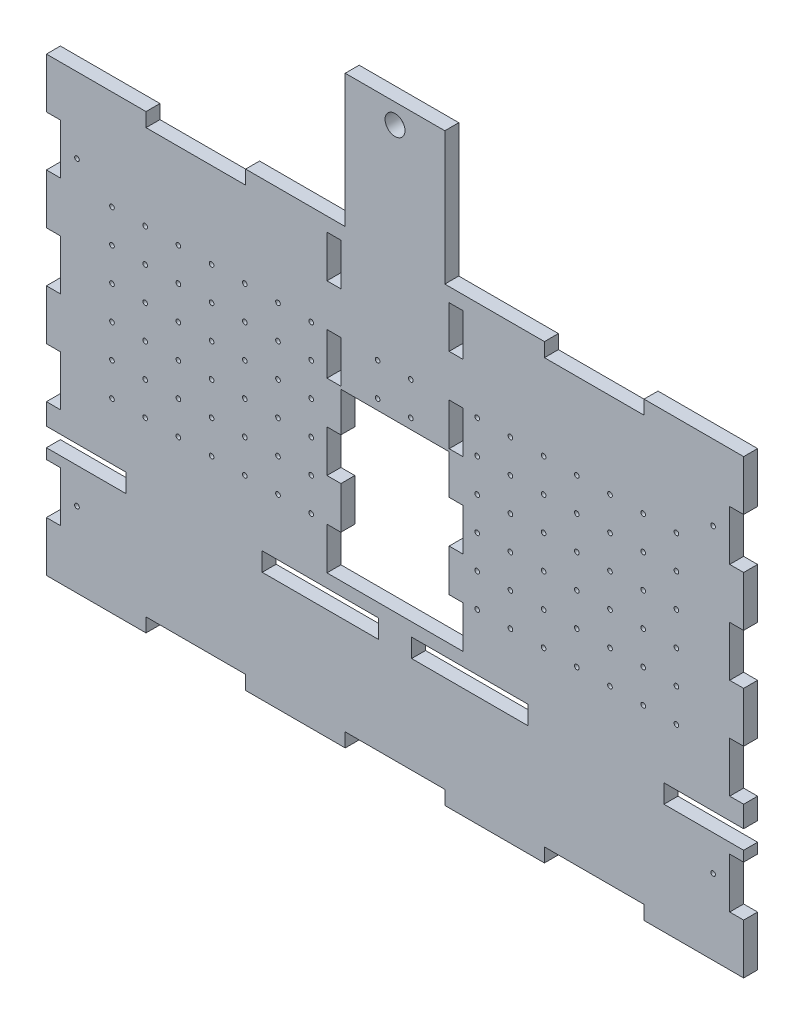
from build123d import *

# Parameters (mm, degrees)
SKETCH1_W           = 266.7
SKETCH1_H           = 172.72
BOSS_EXTRUDE1_DEPTH = 5.334
SKETCH2_W           = 38.1
SKETCH2_H           = 5.334
CUT_EXTRUDE1_DEPTH  = 165.701204222
SKETCH5_W           = 44.45
SKETCH5_H           = 7.112
CUT_EXTRUDE3_DEPTH  = 165.701204222
SKETCH9_W           = 5.334
SKETCH9_H           = 19.191111111
CUT_EXTRUDE7_DEPTH  = 165.701204222
SKETCH10_W          = 38.1
SKETCH10_H          = 5.334
BOSS_EXTRUDE2_DEPTH = 50.8
SKETCH11_W          = 6.604
SKETCH11_H          = 40.64
CUT_EXTRUDE8_DEPTH  = 197.710659379
SKETCH12_R          = 3.81
CUT_EXTRUDE9_DEPTH  = 197.710659379
SKETCH14_R          = 0.889
CUT_EXTRUDE11_DEPTH = 197.710659379
SKETCH15_W          = 6.604
SKETCH15_H          = 10.16
CUT_EXTRUDE12_DEPTH = 197.710659379
SKETCH16_W          = 41.402
SKETCH16_H          = 63.5
CUT_EXTRUDE13_DEPTH = 197.710659379
SKETCH17_W          = 5.334
SKETCH17_H          = 16.124650759
SKETCH17_H_2        = 16.124650758
CUT_EXTRUDE14_DEPTH = 197.710659379
SKETCH18_W          = 38.1
SKETCH18_H          = 56.134
BOSS_EXTRUDE3_DEPTH = 5.334
SKETCH19_W          = 34.756768033
SKETCH19_H          = 54.94363668
CUT_EXTRUDE15_DEPTH = 197.710659379
SKETCH20_R          = 3.81
CUT_EXTRUDE16_DEPTH = 197.710659379
SKETCH21_R          = 0.889
CUT_EXTRUDE17_DEPTH = 197.710659379


with BuildPart() as part:
    # Sketch1 → Boss-Extrude1 (new body)
    with BuildSketch(Plane.XY):
        with Locations((5.474099752, 2.104142138)):
            Rectangle(SKETCH1_W, SKETCH1_H)
    extrude(amount=BOSS_EXTRUDE1_DEPTH)

    # Sketch2 → Cut-Extrude1 (cut, through all)
    with BuildSketch(Plane.XY.offset(5.334)):
        with Locations((-70.725900248, -81.588857862)):
            Rectangle(SKETCH2_W, SKETCH2_H)
        with Locations((5.474099752, -81.588857862)):
            Rectangle(SKETCH2_W, SKETCH2_H)
        with Locations((81.674099752, -81.588857862)):
            Rectangle(SKETCH2_W, SKETCH2_H)
        with Locations((81.674099752, 85.797142138)):
            Rectangle(SKETCH2_W, SKETCH2_H)
        with Locations((5.474099752, 85.797142138)):
            Rectangle(SKETCH2_W, SKETCH2_H)
        with Locations((-70.725900248, 85.797142138)):
            Rectangle(SKETCH2_W, SKETCH2_H)
    extrude(amount=-CUT_EXTRUDE1_DEPTH, mode=Mode.SUBTRACT)

    # Sketch5 → Cut-Extrude3 (cut, through all)
    with BuildSketch(Plane.XY.offset(5.334)):
        with Locations((34.049099752, -38.378413173)):
            Rectangle(SKETCH5_W, SKETCH5_H)
        with Locations((-23.100900248, -38.378413173)):
            Rectangle(SKETCH5_W, SKETCH5_H)
        with Locations((-119.620900248, -38.378413173)):
            Rectangle(SKETCH5_W, SKETCH5_H)
        with Locations((130.569099752, -38.378413173)):
            Rectangle(SKETCH5_W, SKETCH5_H)
    extrude(amount=-CUT_EXTRUDE3_DEPTH, mode=Mode.SUBTRACT)

    # Sketch9 → Cut-Extrude7 (cut, through all)
    with BuildSketch(Plane.XY.offset(5.334)):
        with Locations((-125.208900248, -55.469191196)):
            Rectangle(SKETCH9_W, SKETCH9_H)
        with Locations((-125.208900248, -17.086968973)):
            Rectangle(SKETCH9_W, SKETCH9_H)
        with Locations((-125.208900248, 21.295253249)):
            Rectangle(SKETCH9_W, SKETCH9_H)
        with Locations((-125.208900248, 59.677475472)):
            Rectangle(SKETCH9_W, SKETCH9_H)
        with Locations((136.157099752, 59.677475472)):
            Rectangle(SKETCH9_W, SKETCH9_H)
        with Locations((136.157099752, 21.295253249)):
            Rectangle(SKETCH9_W, SKETCH9_H)
        with Locations((136.157099752, -17.086968973)):
            Rectangle(SKETCH9_W, SKETCH9_H)
        with Locations((136.157099752, -55.469191196)):
            Rectangle(SKETCH9_W, SKETCH9_H)
    extrude(amount=-CUT_EXTRUDE7_DEPTH, mode=Mode.SUBTRACT)

    # Sketch10 → Boss-Extrude2 (add)
    with BuildSketch(Plane(origin=(0, 88.464142138, 0), x_dir=(1, 0, 0), z_dir=(0, 1, 0))):
        with Locations((43.574099752, -2.667)):
            Rectangle(SKETCH10_W, SKETCH10_H)
    extrude(amount=BOSS_EXTRUDE2_DEPTH)

    # Sketch11 → Cut-Extrude8 (cut, through all)
    with BuildSketch(Plane(origin=(0, 0, 0), x_dir=(-1, 0, 0), z_dir=(0, 0, -1))):
        with Locations((-27.826099752, 108.784142138)):
            Rectangle(SKETCH11_W, SKETCH11_H)
    extrude(amount=-CUT_EXTRUDE8_DEPTH, mode=Mode.SUBTRACT)

    # Sketch12 → Cut-Extrude9 (cut, through all)
    with BuildSketch(Plane.XY.offset(5.334)):
        with Locations((43.574099752, 130.476471297)):
            Circle(SKETCH12_R)
    extrude(amount=-CUT_EXTRUDE9_DEPTH, mode=Mode.SUBTRACT)

    # Sketch14 → Cut-Extrude11 (cut, through all)
    with BuildSketch(Plane.XY.offset(5.334)):
        with Locations((-102.797588144, 50.364142138)):
            Circle(SKETCH14_R)
        with Locations((-90.097588144, 50.364142138)):
            Circle(SKETCH14_R)
        with Locations((-77.397588144, 50.364142138)):
            Circle(SKETCH14_R)
        with Locations((-64.697588144, 50.364142138)):
            Circle(SKETCH14_R)
        with Locations((-51.997588144, 50.364142138)):
            Circle(SKETCH14_R)
        with Locations((-39.297588144, 50.364142138)):
            Circle(SKETCH14_R)
        with Locations((-26.597588144, 50.364142138)):
            Circle(SKETCH14_R)
        with Locations((-1.197588144, 50.364142138)):
            Circle(SKETCH14_R)
        with Locations((11.502411856, 50.364142138)):
            Circle(SKETCH14_R)
        with Locations((36.902411856, 50.364142138)):
            Circle(SKETCH14_R)
        with Locations((49.602411856, 50.364142138)):
            Circle(SKETCH14_R)
        with Locations((62.302411856, 50.364142138)):
            Circle(SKETCH14_R)
        with Locations((75.002411856, 50.364142138)):
            Circle(SKETCH14_R)
        with Locations((87.702411856, 50.364142138)):
            Circle(SKETCH14_R)
        with Locations((100.402411856, 50.364142138)):
            Circle(SKETCH14_R)
        with Locations((113.102411856, 50.364142138)):
            Circle(SKETCH14_R)
        with Locations((-102.797588144, 37.664142138)):
            Circle(SKETCH14_R)
        with Locations((-90.097588144, 37.664142138)):
            Circle(SKETCH14_R)
        with Locations((-77.397588144, 37.664142138)):
            Circle(SKETCH14_R)
        with Locations((-64.697588144, 37.664142138)):
            Circle(SKETCH14_R)
        with Locations((-51.997588144, 37.664142138)):
            Circle(SKETCH14_R)
        with Locations((-39.297588144, 37.664142138)):
            Circle(SKETCH14_R)
        with Locations((-26.597588144, 37.664142138)):
            Circle(SKETCH14_R)
        with Locations((-1.197588144, 37.664142138)):
            Circle(SKETCH14_R)
        with Locations((11.502411856, 37.664142138)):
            Circle(SKETCH14_R)
        with Locations((36.902411856, 37.664142138)):
            Circle(SKETCH14_R)
        with Locations((49.602411856, 37.664142138)):
            Circle(SKETCH14_R)
        with Locations((62.302411856, 37.664142138)):
            Circle(SKETCH14_R)
        with Locations((75.002411856, 37.664142138)):
            Circle(SKETCH14_R)
        with Locations((87.702411856, 37.664142138)):
            Circle(SKETCH14_R)
        with Locations((100.402411856, 37.664142138)):
            Circle(SKETCH14_R)
        with Locations((113.102411856, 37.664142138)):
            Circle(SKETCH14_R)
        with Locations((-102.797588144, 24.964142138)):
            Circle(SKETCH14_R)
        with Locations((-90.097588144, 24.964142138)):
            Circle(SKETCH14_R)
        with Locations((-77.397588144, 24.964142138)):
            Circle(SKETCH14_R)
        with Locations((-64.697588144, 24.964142138)):
            Circle(SKETCH14_R)
        with Locations((-51.997588144, 24.964142138)):
            Circle(SKETCH14_R)
        with Locations((-39.297588144, 24.964142138)):
            Circle(SKETCH14_R)
        with Locations((-26.597588144, 24.964142138)):
            Circle(SKETCH14_R)
        with Locations((-1.197588144, 24.964142138)):
            Circle(SKETCH14_R)
        with Locations((11.502411856, 24.964142138)):
            Circle(SKETCH14_R)
        with Locations((36.902411856, 24.964142138)):
            Circle(SKETCH14_R)
        with Locations((49.602411856, 24.964142138)):
            Circle(SKETCH14_R)
        with Locations((62.302411856, 24.964142138)):
            Circle(SKETCH14_R)
        with Locations((75.002411856, 24.964142138)):
            Circle(SKETCH14_R)
        with Locations((87.702411856, 24.964142138)):
            Circle(SKETCH14_R)
        with Locations((100.402411856, 24.964142138)):
            Circle(SKETCH14_R)
        with Locations((113.102411856, 24.964142138)):
            Circle(SKETCH14_R)
        with Locations((-102.797588144, 12.264142138)):
            Circle(SKETCH14_R)
        with Locations((-90.097588144, 12.264142138)):
            Circle(SKETCH14_R)
        with Locations((-77.397588144, 12.264142138)):
            Circle(SKETCH14_R)
        with Locations((-64.697588144, 12.264142138)):
            Circle(SKETCH14_R)
        with Locations((-51.997588144, 12.264142138)):
            Circle(SKETCH14_R)
        with Locations((-39.297588144, 12.264142138)):
            Circle(SKETCH14_R)
        with Locations((-26.597588144, 12.264142138)):
            Circle(SKETCH14_R)
        with Locations((36.902411856, 12.264142138)):
            Circle(SKETCH14_R)
        with Locations((49.602411856, 12.264142138)):
            Circle(SKETCH14_R)
        with Locations((62.302411856, 12.264142138)):
            Circle(SKETCH14_R)
        with Locations((75.002411856, 12.264142138)):
            Circle(SKETCH14_R)
        with Locations((87.702411856, 12.264142138)):
            Circle(SKETCH14_R)
        with Locations((100.402411856, 12.264142138)):
            Circle(SKETCH14_R)
        with Locations((113.102411856, 12.264142138)):
            Circle(SKETCH14_R)
        with Locations((-102.797588144, -0.435857862)):
            Circle(SKETCH14_R)
        with Locations((-90.097588144, -0.435857862)):
            Circle(SKETCH14_R)
        with Locations((-77.397588144, -0.435857862)):
            Circle(SKETCH14_R)
        with Locations((-64.697588144, -0.435857862)):
            Circle(SKETCH14_R)
        with Locations((-51.997588144, -0.435857862)):
            Circle(SKETCH14_R)
        with Locations((-39.297588144, -0.435857862)):
            Circle(SKETCH14_R)
        with Locations((-26.597588144, -0.435857862)):
            Circle(SKETCH14_R)
        with Locations((-13.897588144, -0.435857862)):
            Circle(SKETCH14_R)
        with Locations((-1.197588144, -0.435857862)):
            Circle(SKETCH14_R)
        with Locations((11.502411856, -0.435857862)):
            Circle(SKETCH14_R)
        with Locations((24.202411856, -0.435857862)):
            Circle(SKETCH14_R)
        with Locations((36.902411856, -0.435857862)):
            Circle(SKETCH14_R)
        with Locations((49.602411856, -0.435857862)):
            Circle(SKETCH14_R)
        with Locations((62.302411856, -0.435857862)):
            Circle(SKETCH14_R)
        with Locations((75.002411856, -0.435857862)):
            Circle(SKETCH14_R)
        with Locations((87.702411856, -0.435857862)):
            Circle(SKETCH14_R)
        with Locations((100.402411856, -0.435857862)):
            Circle(SKETCH14_R)
        with Locations((113.102411856, -0.435857862)):
            Circle(SKETCH14_R)
        with Locations((-102.797588144, -13.135857862)):
            Circle(SKETCH14_R)
        with Locations((-90.097588144, -13.135857862)):
            Circle(SKETCH14_R)
        with Locations((-77.397588144, -13.135857862)):
            Circle(SKETCH14_R)
        with Locations((-64.697588144, -13.135857862)):
            Circle(SKETCH14_R)
        with Locations((-51.997588144, -13.135857862)):
            Circle(SKETCH14_R)
        with Locations((-39.297588144, -13.135857862)):
            Circle(SKETCH14_R)
        with Locations((-26.597588144, -13.135857862)):
            Circle(SKETCH14_R)
        with Locations((-13.897588144, -13.135857862)):
            Circle(SKETCH14_R)
        with Locations((-1.197588144, -13.135857862)):
            Circle(SKETCH14_R)
        with Locations((11.502411856, -13.135857862)):
            Circle(SKETCH14_R)
        with Locations((24.202411856, -13.135857862)):
            Circle(SKETCH14_R)
        with Locations((36.902411856, -13.135857862)):
            Circle(SKETCH14_R)
        with Locations((49.602411856, -13.135857862)):
            Circle(SKETCH14_R)
        with Locations((62.302411856, -13.135857862)):
            Circle(SKETCH14_R)
        with Locations((75.002411856, -13.135857862)):
            Circle(SKETCH14_R)
        with Locations((87.702411856, -13.135857862)):
            Circle(SKETCH14_R)
        with Locations((100.402411856, -13.135857862)):
            Circle(SKETCH14_R)
        with Locations((113.102411856, -13.135857862)):
            Circle(SKETCH14_R)
    extrude(amount=-CUT_EXTRUDE11_DEPTH, mode=Mode.SUBTRACT)

    # Sketch15 → Cut-Extrude12 (cut, through all)
    with BuildSketch(Plane.XY.offset(5.334)):
        with Locations((27.826099752, 134.184142138)):
            Rectangle(SKETCH15_W, SKETCH15_H)
    extrude(amount=-CUT_EXTRUDE12_DEPTH, mode=Mode.SUBTRACT)

    # Sketch16 → Cut-Extrude13 (cut, through all)
    with BuildSketch(Plane.XY.offset(5.334)):
        with Locations((5.474099752, 2.007586827)):
            Rectangle(SKETCH16_W, SKETCH16_H)
    extrude(amount=-CUT_EXTRUDE13_DEPTH, mode=Mode.SUBTRACT)

    # Sketch17 → Cut-Extrude14 (cut, through all)
    with BuildSketch(Plane.XY.offset(5.334)):
        with Locations((-17.893900248, -21.680087794)):
            Rectangle(SKETCH17_W, SKETCH17_H)
        with Locations((-17.893900248, 10.569213724)):
            Rectangle(SKETCH17_W, SKETCH17_H)
        with Locations((-17.893900248, 42.818515241)):
            Rectangle(SKETCH17_W, SKETCH17_H_2)
        with Locations((-17.893900248, 75.067816759)):
            Rectangle(SKETCH17_W, SKETCH17_H)
        with Locations((28.842099752, 75.067816759)):
            Rectangle(SKETCH17_W, SKETCH17_H)
        with Locations((28.842099752, 42.818515241)):
            Rectangle(SKETCH17_W, SKETCH17_H_2)
        with Locations((28.842099752, 10.569213724)):
            Rectangle(SKETCH17_W, SKETCH17_H)
        with Locations((28.842099752, -21.680087794)):
            Rectangle(SKETCH17_W, SKETCH17_H)
    extrude(amount=-CUT_EXTRUDE14_DEPTH, mode=Mode.SUBTRACT)

    # Sketch18 → Boss-Extrude3 (add)
    with BuildSketch(Plane.XY.offset(5.334)):
        with Locations((5.474099752, 111.197142138)):
            Rectangle(SKETCH18_W, SKETCH18_H)
    extrude(amount=-BOSS_EXTRUDE3_DEPTH)

    # Sketch19 → Cut-Extrude15 (cut, through all)
    with BuildSketch(Plane.XY.offset(5.334)):
        with Locations((48.506483768, 115.935960478)):
            Rectangle(SKETCH19_W, SKETCH19_H)
    extrude(amount=-CUT_EXTRUDE15_DEPTH, mode=Mode.SUBTRACT)

    # Sketch20 → Cut-Extrude16 (cut, through all)
    with BuildSketch(Plane.XY.offset(5.334)):
        with Locations((5.474099752, 131.644142138)):
            Circle(SKETCH20_R)
    extrude(amount=-CUT_EXTRUDE16_DEPTH, mode=Mode.SUBTRACT)

    # Sketch21 → Cut-Extrude17 (cut, through all)
    with BuildSketch(Plane.XY.offset(5.334)):
        with Locations((127.140099752, 59.677475471)):
            Circle(SKETCH21_R)
        with Locations((-116.191900248, 59.677475471)):
            Circle(SKETCH21_R)
        with Locations((-116.191900248, -55.469191196)):
            Circle(SKETCH21_R)
        with Locations((127.140099752, -55.469191196)):
            Circle(SKETCH21_R)
    extrude(amount=-CUT_EXTRUDE17_DEPTH, mode=Mode.SUBTRACT)


solid = part.part
